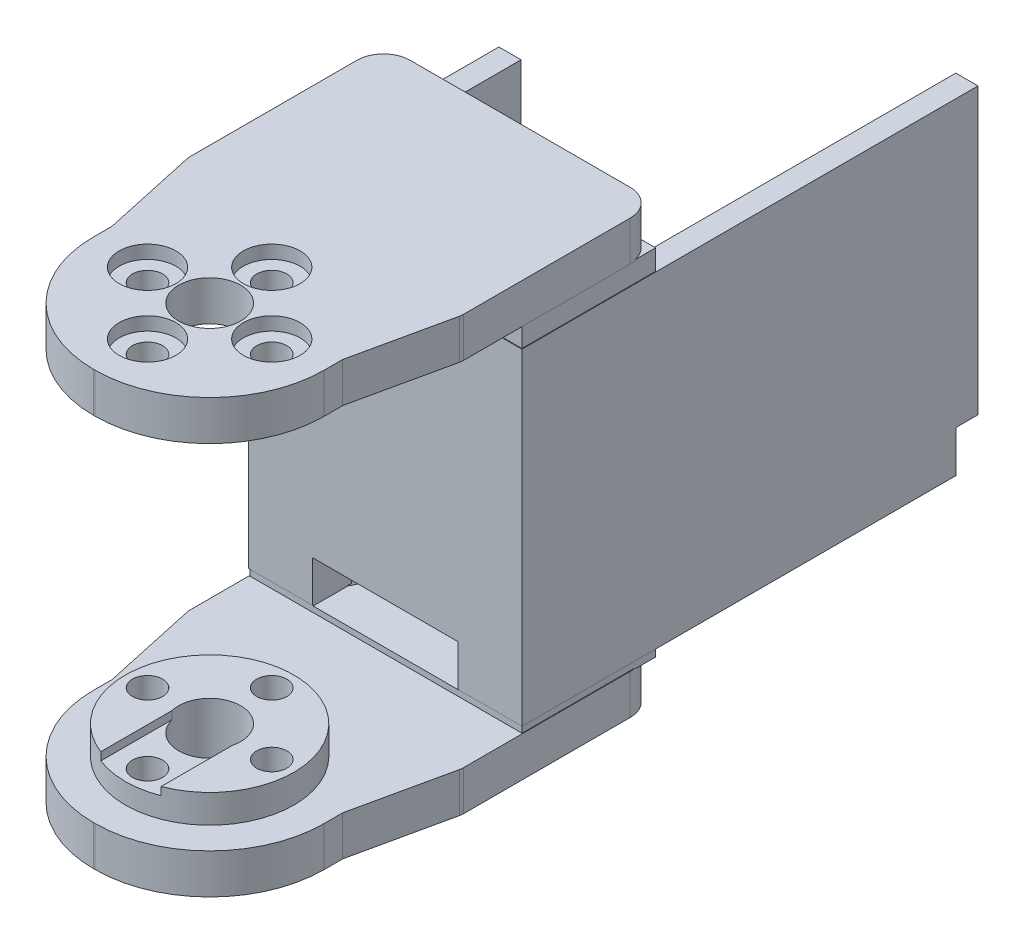
from build123d import *

# Parameters (mm, degrees)
BOSS_1_DEPTH    = 4.5
S_CYL2_R        = 9.5
BOSS_2_DEPTH    = 3.2
BOSS_3_DEPTH    = 4.5
S_BOX4_W        = 30.8
S_BOX4_H        = 36.8
BOSS_4_DEPTH    = 2.5
S_BOX5_W        = 2.5
S_BOX5_H        = 36.8
BOSS_5_DEPTH    = 51.4
S_BOX6_W        = 30.8
S_BOX6_H        = 4.6
BOSS_6_DEPTH    = 51.4
S_BOX7_W        = 2.5
S_BOX7_H        = 36.8
BOSS_7_DEPTH    = 28.2
S_BOX8_W        = 30.66
S_BOX8_H        = 2.4
BOSS_8_DEPTH    = 15.06
S_BOX9_W        = 30.66
S_BOX9_H        = 0.95
BOSS_9_DEPTH    = 15.06
S_HOLE10_R      = 3.5
HOLE_10_DEPTH   = 4.7
S_HOLE11_R      = 1.7
HOLE_11_DEPTH   = 4.7
S_HOLE12_R      = 1.7
HOLE_12_DEPTH   = 4.7
S_HOLE13_R      = 1.7
HOLE_13_DEPTH   = 4.7
S_HOLE14_R      = 1.7
HOLE_14_DEPTH   = 4.7
S_HOLE15_R      = 3.2
HOLE_15_DEPTH   = 1.6
S_HOLE16_R      = 3.2
HOLE_16_DEPTH   = 1.6
S_HOLE17_R      = 3.2
HOLE_17_DEPTH   = 1.6
S_HOLE18_R      = 3.2
HOLE_18_DEPTH   = 1.6
S_HOLE19_R      = 3.5
HOLE_19_DEPTH   = 7.9
S_HOLE20_R      = 1.7
HOLE_20_DEPTH   = 7.9
S_HOLE21_R      = 1.7
HOLE_21_DEPTH   = 7.9
S_HOLE22_R      = 1.7
HOLE_22_DEPTH   = 7.9
S_HOLE23_R      = 1.7
HOLE_23_DEPTH   = 7.9
S_HOLE24_R      = 3.2
HOLE_24_DEPTH   = 2.1
S_HOLE25_R      = 3.2
HOLE_25_DEPTH   = 2.1
S_HOLE26_R      = 3.2
HOLE_26_DEPTH   = 2.1
S_HOLE27_R      = 3.2
HOLE_27_DEPTH   = 2.1
S_CUT28_W       = 6.8
S_CUT28_H       = 1
POCKET_28_DEPTH = 10
S_HOLE29_R      = 10.5
HOLE_29_DEPTH   = 4.8
S_CUT30_W       = 19.4
S_CUT30_H       = 4.75
POCKET_30_DEPTH = 19.5
S_CUT31_W       = 16.4
S_CUT31_H       = 4.75
POCKET_31_DEPTH = 8.3
S_CUT32_W       = 7
S_CUT32_H       = 4.75
POCKET_32_DEPTH = 11
S_CUT33_W       = 20
S_CUT33_H       = 2.9
POCKET_33_DEPTH = 13.7
S_HOLE34_R      = 1.1
HOLE_34_DEPTH   = 4.8
S_HOLE35_R      = 2.3
HOLE_35_DEPTH   = 1.7
S_HOLE36_R      = 1.1
HOLE_36_DEPTH   = 4.8
S_HOLE37_R      = 2.3
HOLE_37_DEPTH   = 1.7
S_CUT38_W       = 31
S_CUT38_H       = 4.8
POCKET_38_DEPTH = 2.6
S_CUT39_W       = 19
S_CUT39_H       = 4.75
POCKET_39_DEPTH = 22.2
S_CUT40_W       = 15
S_CUT40_H       = 1.55
POCKET_40_DEPTH = 27.4
S_HOLE41_R      = 2.5
HOLE_41_DEPTH   = 5.3
S_HOLE42_R      = 2.5
HOLE_42_DEPTH   = 5.3


with BuildPart() as part:
    # S_prism1 → Boss_1 (new body)
    with BuildSketch(Plane(origin=(0, 18.8, 0), x_dir=(1, 0, 0), z_dir=(0, 1, 0))):
        with BuildLine():
            Line((-13, 2), (-15.354, 12.7893))
            ThreePointArc((-15.354, 12.7893), (-15.38850097, 13.001208985), (-15.4, 13.2156))
            Line((-15.4, 13.2156), (-15.4, 32))
            ThreePointArc((-15.4, 32), (-14.5213, 34.1213), (-12.4, 35))
            Line((-12.4, 35), (12.4, 35))
            ThreePointArc((12.4, 35), (14.5213, 34.1213), (15.4, 32))
            Line((15.4, 32), (15.4, 13.2156))
            ThreePointArc((15.4, 13.2156), (15.38850097, 13.001208985), (15.354, 12.7893))
            Line((15.354, 12.7893), (13, 2))
            Line((13, 2), (13, -0.1))
            ThreePointArc((13, -0.1), (9.2217, -9.2217), (0.1, -13))
            Line((0.1, -13), (-0.1, -13))
            ThreePointArc((-0.1, -13), (-9.2217, -9.2217), (-13, -0.1))
            Line((-13, -0.1), (-13, 2))
        make_face()
    extrude(amount=BOSS_1_DEPTH)



with BuildPart() as body_2:
    # S_cyl2 → Boss_2 (new body)
    with BuildSketch(Plane(origin=(0, -20.95, 0), x_dir=(1, 0, 0), z_dir=(0, 1, 0))):
        Circle(S_CYL2_R)
    extrude(amount=BOSS_2_DEPTH)

    # S_prism3 → Boss_3 (add)
    with BuildSketch(Plane(origin=(0, -25.45, 0), x_dir=(1, 0, 0), z_dir=(0, 1, 0))):
        with BuildLine():
            Line((-13, 2), (-15.354, 12.7893))
            ThreePointArc((-15.354, 12.7893), (-15.38850097, 13.001208985), (-15.4, 13.2156))
            Line((-15.4, 13.2156), (-15.4, 32))
            ThreePointArc((-15.4, 32), (-14.5213, 34.1213), (-12.4, 35))
            Line((-12.4, 35), (12.4, 35))
            ThreePointArc((12.4, 35), (14.5213, 34.1213), (15.4, 32))
            Line((15.4, 32), (15.4, 13.2156))
            ThreePointArc((15.4, 13.2156), (15.38850097, 13.001208985), (15.354, 12.7893))
            Line((15.354, 12.7893), (13, 2))
            Line((13, 2), (13, -0.1))
            ThreePointArc((13, -0.1), (9.2217, -9.2217), (0.1, -13))
            Line((0.1, -13), (-0.1, -13))
            ThreePointArc((-0.1, -13), (-9.2217, -9.2217), (-13, -0.1))
            Line((-13, -0.1), (-13, 2))
        make_face()
    extrude(amount=BOSS_3_DEPTH)


with BuildPart() as body_3:
    # S_box4 → Boss_4 (new body)
    with BuildSketch(Plane.XY.offset(-22.3)):
        with Locations((0, -1.8)):
            Rectangle(S_BOX4_W, S_BOX4_H)
    extrude(amount=BOSS_4_DEPTH)

    # S_box5 → Boss_5 (add)
    with BuildSketch(Plane.XY.offset(-71.2)):
        with Locations((14.15, -1.8)):
            Rectangle(S_BOX5_W, S_BOX5_H)
    extrude(amount=BOSS_5_DEPTH)

    # S_box6 → Boss_6 (add)
    with BuildSketch(Plane.XY.offset(-71.2)):
        with Locations((0, -17.9)):
            Rectangle(S_BOX6_W, S_BOX6_H)
    extrude(amount=BOSS_6_DEPTH)

    # S_box7 → Boss_7 (add)
    with BuildSketch(Plane.XY.offset(-48)):
        with Locations((-14.15, -1.8)):
            Rectangle(S_BOX7_W, S_BOX7_H)
    extrude(amount=BOSS_7_DEPTH)


with BuildPart() as part_1:
    add(part.part)

    add(body_3.part)  # Boss_8 merges body 3
    # S_box8 → Boss_8 (add)
    with BuildSketch(Plane.XY.offset(-34.93)):
        with Locations((0, 17.7)):
            Rectangle(S_BOX8_W, S_BOX8_H)
    extrude(amount=BOSS_8_DEPTH)


    add(body_2.part)  # Boss_9 merges body 2
    # S_box9 → Boss_9 (add)
    with BuildSketch(Plane.XY.offset(-34.93)):
        with Locations((0, -20.575)):
            Rectangle(S_BOX9_W, S_BOX9_H)
    extrude(amount=BOSS_9_DEPTH)

    # S_hole10 → Hole_10 (cut)
    with BuildSketch(Plane(origin=(0, 18.7, 0), x_dir=(1, 0, 0), z_dir=(0, 1, 0))):
        Circle(S_HOLE10_R)
    extrude(amount=HOLE_10_DEPTH, mode=Mode.SUBTRACT)

    # S_hole11 → Hole_11 (cut)
    with BuildSketch(Plane(origin=(0, 18.7, 0), x_dir=(1, 0, 0), z_dir=(0, 1, 0))):
        with Locations((7, 0)):
            Circle(S_HOLE11_R)
    extrude(amount=HOLE_11_DEPTH, mode=Mode.SUBTRACT)

    # S_hole12 → Hole_12 (cut)
    with BuildSketch(Plane(origin=(0, 18.7, 0), x_dir=(1, 0, 0), z_dir=(0, 1, 0))):
        with Locations((0, -7)):
            Circle(S_HOLE12_R)
    extrude(amount=HOLE_12_DEPTH, mode=Mode.SUBTRACT)

    # S_hole13 → Hole_13 (cut)
    with BuildSketch(Plane(origin=(0, 18.7, 0), x_dir=(1, 0, 0), z_dir=(0, 1, 0))):
        with Locations((-7, 0)):
            Circle(S_HOLE13_R)
    extrude(amount=HOLE_13_DEPTH, mode=Mode.SUBTRACT)

    # S_hole14 → Hole_14 (cut)
    with BuildSketch(Plane(origin=(0, 18.7, 0), x_dir=(1, 0, 0), z_dir=(0, 1, 0))):
        with Locations((0, 7)):
            Circle(S_HOLE14_R)
    extrude(amount=HOLE_14_DEPTH, mode=Mode.SUBTRACT)

    # S_hole15 → Hole_15 (cut)
    with BuildSketch(Plane(origin=(0, 21.8, 0), x_dir=(1, 0, 0), z_dir=(0, 1, 0))):
        with Locations((7, 0)):
            Circle(S_HOLE15_R)
    extrude(amount=HOLE_15_DEPTH, mode=Mode.SUBTRACT)

    # S_hole16 → Hole_16 (cut)
    with BuildSketch(Plane(origin=(0, 21.8, 0), x_dir=(1, 0, 0), z_dir=(0, 1, 0))):
        with Locations((0, -7)):
            Circle(S_HOLE16_R)
    extrude(amount=HOLE_16_DEPTH, mode=Mode.SUBTRACT)

    # S_hole17 → Hole_17 (cut)
    with BuildSketch(Plane(origin=(0, 21.8, 0), x_dir=(1, 0, 0), z_dir=(0, 1, 0))):
        with Locations((-7, 0)):
            Circle(S_HOLE17_R)
    extrude(amount=HOLE_17_DEPTH, mode=Mode.SUBTRACT)

    # S_hole18 → Hole_18 (cut)
    with BuildSketch(Plane(origin=(0, 21.8, 0), x_dir=(1, 0, 0), z_dir=(0, 1, 0))):
        with Locations((0, 7)):
            Circle(S_HOLE18_R)
    extrude(amount=HOLE_18_DEPTH, mode=Mode.SUBTRACT)

    # S_hole19 → Hole_19 (cut)
    with BuildSketch(Plane(origin=(0, -25.55, 0), x_dir=(1, 0, 0), z_dir=(0, 1, 0))):
        Circle(S_HOLE19_R)
    extrude(amount=HOLE_19_DEPTH, mode=Mode.SUBTRACT)

    # S_hole20 → Hole_20 (cut)
    with BuildSketch(Plane(origin=(0, -25.55, 0), x_dir=(1, 0, 0), z_dir=(0, 1, 0))):
        with Locations((7, 0)):
            Circle(S_HOLE20_R)
    extrude(amount=HOLE_20_DEPTH, mode=Mode.SUBTRACT)

    # S_hole21 → Hole_21 (cut)
    with BuildSketch(Plane(origin=(0, -25.55, 0), x_dir=(1, 0, 0), z_dir=(0, 1, 0))):
        with Locations((0, -7)):
            Circle(S_HOLE21_R)
    extrude(amount=HOLE_21_DEPTH, mode=Mode.SUBTRACT)

    # S_hole22 → Hole_22 (cut)
    with BuildSketch(Plane(origin=(0, -25.55, 0), x_dir=(1, 0, 0), z_dir=(0, 1, 0))):
        with Locations((-7, 0)):
            Circle(S_HOLE22_R)
    extrude(amount=HOLE_22_DEPTH, mode=Mode.SUBTRACT)

    # S_hole23 → Hole_23 (cut)
    with BuildSketch(Plane(origin=(0, -25.55, 0), x_dir=(1, 0, 0), z_dir=(0, 1, 0))):
        with Locations((0, 7)):
            Circle(S_HOLE23_R)
    extrude(amount=HOLE_23_DEPTH, mode=Mode.SUBTRACT)

    # S_hole24 → Hole_24 (cut)
    with BuildSketch(Plane(origin=(0, -25.55, 0), x_dir=(1, 0, 0), z_dir=(0, 1, 0))):
        with Locations((7, 0)):
            Circle(S_HOLE24_R)
    extrude(amount=HOLE_24_DEPTH, mode=Mode.SUBTRACT)

    # S_hole25 → Hole_25 (cut)
    with BuildSketch(Plane(origin=(0, -25.55, 0), x_dir=(1, 0, 0), z_dir=(0, 1, 0))):
        with Locations((0, -7)):
            Circle(S_HOLE25_R)
    extrude(amount=HOLE_25_DEPTH, mode=Mode.SUBTRACT)

    # S_hole26 → Hole_26 (cut)
    with BuildSketch(Plane(origin=(0, -25.55, 0), x_dir=(1, 0, 0), z_dir=(0, 1, 0))):
        with Locations((-7, 0)):
            Circle(S_HOLE26_R)
    extrude(amount=HOLE_26_DEPTH, mode=Mode.SUBTRACT)

    # S_hole27 → Hole_27 (cut)
    with BuildSketch(Plane(origin=(0, -25.55, 0), x_dir=(1, 0, 0), z_dir=(0, 1, 0))):
        with Locations((0, 7)):
            Circle(S_HOLE27_R)
    extrude(amount=HOLE_27_DEPTH, mode=Mode.SUBTRACT)

    # S_cut28 → Pocket_28 (cut)
    with BuildSketch(Plane.XY):
        with Locations((0, -18.15)):
            Rectangle(S_CUT28_W, S_CUT28_H)
    extrude(amount=POCKET_28_DEPTH, mode=Mode.SUBTRACT)

    # S_hole29 → Hole_29 (cut)
    with BuildSketch(Plane(origin=(0, -20.3, 0), x_dir=(1, 0, 0), z_dir=(0, 1, 0))):
        with Locations((0, 58)):
            Circle(S_HOLE29_R)
    extrude(amount=HOLE_29_DEPTH, mode=Mode.SUBTRACT)

    # S_cut30 → Pocket_30 (cut)
    with BuildSketch(Plane.XY.offset(-47.1)):
        with Locations((0, -17.925)):
            Rectangle(S_CUT30_W, S_CUT30_H)
    extrude(amount=POCKET_30_DEPTH, mode=Mode.SUBTRACT)

    # S_cut31 → Pocket_31 (cut)
    with BuildSketch(Plane.XY.offset(-27.6)):
        with Locations((0, -17.925)):
            Rectangle(S_CUT31_W, S_CUT31_H)
    extrude(amount=POCKET_31_DEPTH, mode=Mode.SUBTRACT)

    # S_cut32 → Pocket_32 (cut)
    with BuildSketch(Plane.XY.offset(-58)):
        with Locations((0, -17.925)):
            Rectangle(S_CUT32_W, S_CUT32_H)
    extrude(amount=POCKET_32_DEPTH, mode=Mode.SUBTRACT)

    # S_cut33 → Pocket_33 (cut)
    with BuildSketch(Plane.XY.offset(-71.7)):
        with Locations((0, -18.95)):
            Rectangle(S_CUT33_W, S_CUT33_H)
    extrude(amount=POCKET_33_DEPTH, mode=Mode.SUBTRACT)

    # S_hole34 → Hole_34 (cut)
    with BuildSketch(Plane(origin=(0, -20.3, 0), x_dir=(1, 0, 0), z_dir=(0, 1, 0))):
        with Locations((-10.25, 25.25)):
            Circle(S_HOLE34_R)
    extrude(amount=HOLE_34_DEPTH, mode=Mode.SUBTRACT)

    # S_hole35 → Hole_35 (cut)
    with BuildSketch(Plane(origin=(0, -20.3, 0), x_dir=(1, 0, 0), z_dir=(0, 1, 0))):
        with Locations((-10.25, 25.25)):
            Circle(S_HOLE35_R)
    extrude(amount=HOLE_35_DEPTH, mode=Mode.SUBTRACT)

    # S_hole36 → Hole_36 (cut)
    with BuildSketch(Plane(origin=(0, -20.3, 0), x_dir=(1, 0, 0), z_dir=(0, 1, 0))):
        with Locations((10.25, 25.25)):
            Circle(S_HOLE36_R)
    extrude(amount=HOLE_36_DEPTH, mode=Mode.SUBTRACT)

    # S_hole37 → Hole_37 (cut)
    with BuildSketch(Plane(origin=(0, -20.3, 0), x_dir=(1, 0, 0), z_dir=(0, 1, 0))):
        with Locations((10.25, 25.25)):
            Circle(S_HOLE37_R)
    extrude(amount=HOLE_37_DEPTH, mode=Mode.SUBTRACT)

    # S_cut38 → Pocket_38 (cut)
    with BuildSketch(Plane.XY.offset(-71.3)):
        with Locations((0, -17.9)):
            Rectangle(S_CUT38_W, S_CUT38_H)
    extrude(amount=POCKET_38_DEPTH, mode=Mode.SUBTRACT)

    # S_cut39 → Pocket_39 (cut)
    with BuildSketch(Plane.XY.offset(-68.8)):
        with Locations((0, -17.925)):
            Rectangle(S_CUT39_W, S_CUT39_H)
    extrude(amount=POCKET_39_DEPTH, mode=Mode.SUBTRACT)

    # S_cut40 → Pocket_40 (cut)
    with BuildSketch(Plane.XY.offset(-49.9)):
        with Locations((0, 16.975)):
            Rectangle(S_CUT40_W, S_CUT40_H)
    extrude(amount=POCKET_40_DEPTH, mode=Mode.SUBTRACT)

    # S_hole41 → Hole_41 (cut)
    with BuildSketch(Plane(origin=(0, -25.55, 0), x_dir=(1, 0, 0), z_dir=(0, 1, 0))):
        with Locations((-10.25, 25.25)):
            Circle(S_HOLE41_R)
    extrude(amount=HOLE_41_DEPTH, mode=Mode.SUBTRACT)

    # S_hole42 → Hole_42 (cut)
    with BuildSketch(Plane(origin=(0, -25.55, 0), x_dir=(1, 0, 0), z_dir=(0, 1, 0))):
        with Locations((10.25, 25.25)):
            Circle(S_HOLE42_R)
    extrude(amount=HOLE_42_DEPTH, mode=Mode.SUBTRACT)


solid = part_1.part
